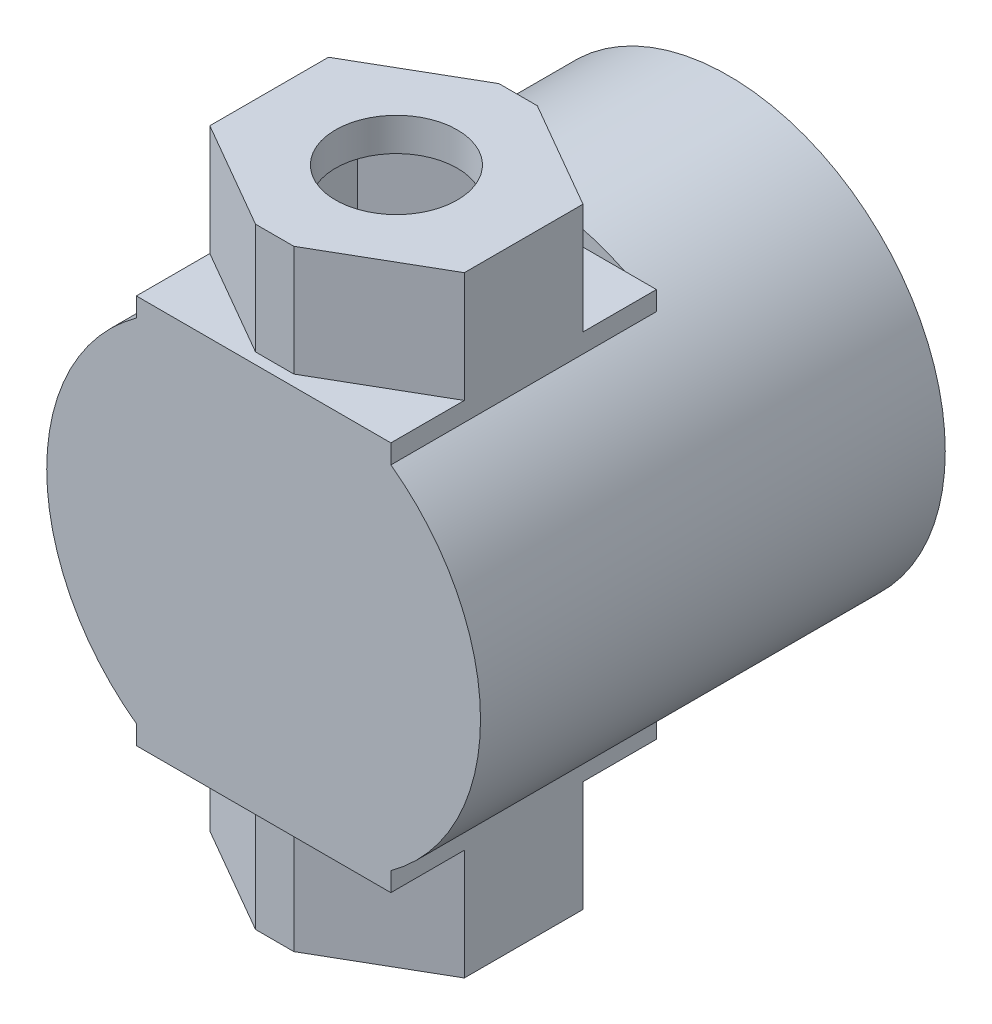
from build123d import *

# Parameters (mm, degrees)
BOSS_EXTRUDE1_DEPTH            = 12
BOSS_EXTRUDE2_DEPTH            = 5
BOSS_EXTRUDE3_DEPTH            = 5
BOSS_EXTRUDE4_START            = 9
SKETCH4_R                      = 9.8
BOSS_EXTRUDE4_DEPTH            = 9
CUT_THICKEN1_START             = -12.3
CUT_THICKEN1_DEPTH             = 24.6
SKETCH5_W                      = 8
SKETCH5_H                      = 18
F_5_5_5_5_DIAMETER_HOLE1_D     = 5.5
F_5_5_5_5_DIAMETER_HOLE1_DEPTH = 1.5
F_5_5_5_5_DIAMETER_HOLE2_D     = 5.5


# Read off the part's stored shape, not the designer's step: Cut-Thicken1
with BuildPart() as part:
    # Sketch1 → Boss-Extrude1 (new body)
    with BuildSketch(Plane(origin=(0, 0, -11), x_dir=(-1, 0, 0), z_dir=(0, 0, -1))):
        with BuildLine():
            Line((24.25, -7.93583644), (24.25, -8.8))
            Line((24.25, -8.8), (35.75, -8.8))
            Line((35.75, -8.8), (35.75, -7.93583644))
            ThreePointArc((35.75, -7.93583644), (39.8, 0), (35.75, 7.93583644))
            Line((35.75, 7.93583644), (35.75, 8.8))
            Line((35.75, 8.8), (24.25, 8.8))
            Line((24.25, 8.8), (24.25, 7.93583644))
            ThreePointArc((24.25, 7.93583644), (20.2, 0), (24.25, -7.93583644))
        make_face()
    extrude(amount=-BOSS_EXTRUDE1_DEPTH)

    # Sketch2 → Boss-Extrude2 (add)
    with BuildSketch(Plane(origin=(0, 8.8, 0), x_dir=(-1, 0, 0), z_dir=(0, 1, 0))):
        Polygon((29.133974596, 0.5), (30.866025404, 0.5), (35.75, -2.319764048), (35.75, -7.680235952), (30.866025404, -10.5), (29.133974596, -10.5), (24.25, -7.680235952), (24.25, -2.319764048), align=None)
    extrude(amount=BOSS_EXTRUDE2_DEPTH)

    # Sketch3 → Boss-Extrude3 (add)
    with BuildSketch(Plane.XZ.offset(8.8)):
        Polygon((-35.75, -2.319764048), (-30.866025404, 0.5), (-29.133974596, 0.5), (-24.25, -2.319764048), (-24.25, -7.680235952), (-29.133974596, -10.5), (-30.866025404, -10.5), (-35.75, -7.680235952), align=None)
    extrude(amount=BOSS_EXTRUDE3_DEPTH)

    # Sketch4 → Boss-Extrude4 (add)
    with BuildSketch(Plane(origin=(0, 0, -11), x_dir=(-1, 0, 0), z_dir=(0, 0, -1)).offset(BOSS_EXTRUDE4_START)):
        with Locations((30, 0)):
            Circle(SKETCH4_R)
    extrude(amount=-BOSS_EXTRUDE4_DEPTH)

    # Cut-Thicken1 outline → Cut-Thicken1 (cut)
    with BuildSketch(Plane(origin=(0, 0, 0), x_dir=(1, 0, 0), z_dir=(0, 1, 0)).offset(CUT_THICKEN1_START)):
        Polygon((-30, 9.792007234), (-34.15, 7.396003617), (-34.15, 2.603996383), (-30, 0.207992766), (-25.85, 2.603996383), (-25.85, 7.396003617), align=None)
    extrude(amount=CUT_THICKEN1_DEPTH, mode=Mode.SUBTRACT)

    # Sketch5 → Cut-Revolve1 (revolve, cut)
    with BuildSketch(Plane(origin=(0, 0, 0), x_dir=(1, 0, 0), z_dir=(0, 1, 0))):
        with Locations((-34, 11)):
            Rectangle(SKETCH5_W, SKETCH5_H)
    revolve(axis=Axis((-30, 0, -2), (0, 0, -1)), mode=Mode.SUBTRACT)

    # Ø5.5 (5.5) Diameter Hole1
    with Locations(Plane(origin=(0, 12.3, 0), x_dir=(-1, 0, 0), z_dir=(0, -1, 0))):
        with Locations((30, 5)):
            Hole(F_5_5_5_5_DIAMETER_HOLE1_D / 2, depth=F_5_5_5_5_DIAMETER_HOLE1_DEPTH)

    # Ø5.5 (5.5) Diameter Hole2 (through all)
    with Locations(Plane(origin=(0, -12.3, 0), x_dir=(1, 0, 0), z_dir=(0, 1, 0))):
        with Locations((-30, 5)):
            Hole(F_5_5_5_5_DIAMETER_HOLE2_D / 2)


solid = part.part
